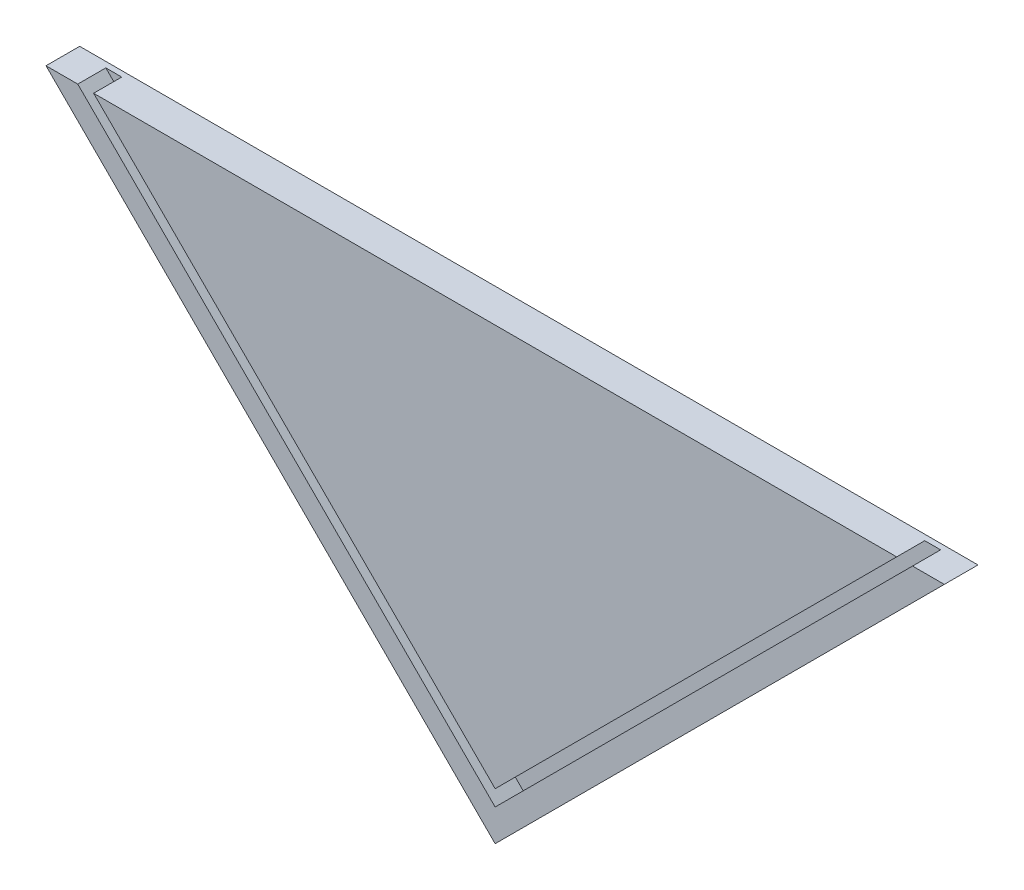
from build123d import *

# Parameters (mm, degrees)
BOSS_EXTRUDE1_DEPTH = 3
CUT_EXTRUDE2_DEPTH  = 2.5


with BuildPart() as part:
    # Sketch1 → Boss-Extrude1 (new body)
    with BuildSketch(Plane.XY):
        Polygon((0, 0), (40, 40), (-40, 40), align=None)
    extrude(amount=BOSS_EXTRUDE1_DEPTH)

    # Sketch2 → Cut-Extrude2 (cut)
    with BuildSketch(Plane.XY.offset(3)):
        Polygon((0, 2.828427125), (-37.171572875, 40), (-35.757359313, 40), (0, 4.242640687), (35.757359313, 40), (37.171572875, 40), align=None)
    extrude(amount=-CUT_EXTRUDE2_DEPTH, mode=Mode.SUBTRACT)


solid = part.part
